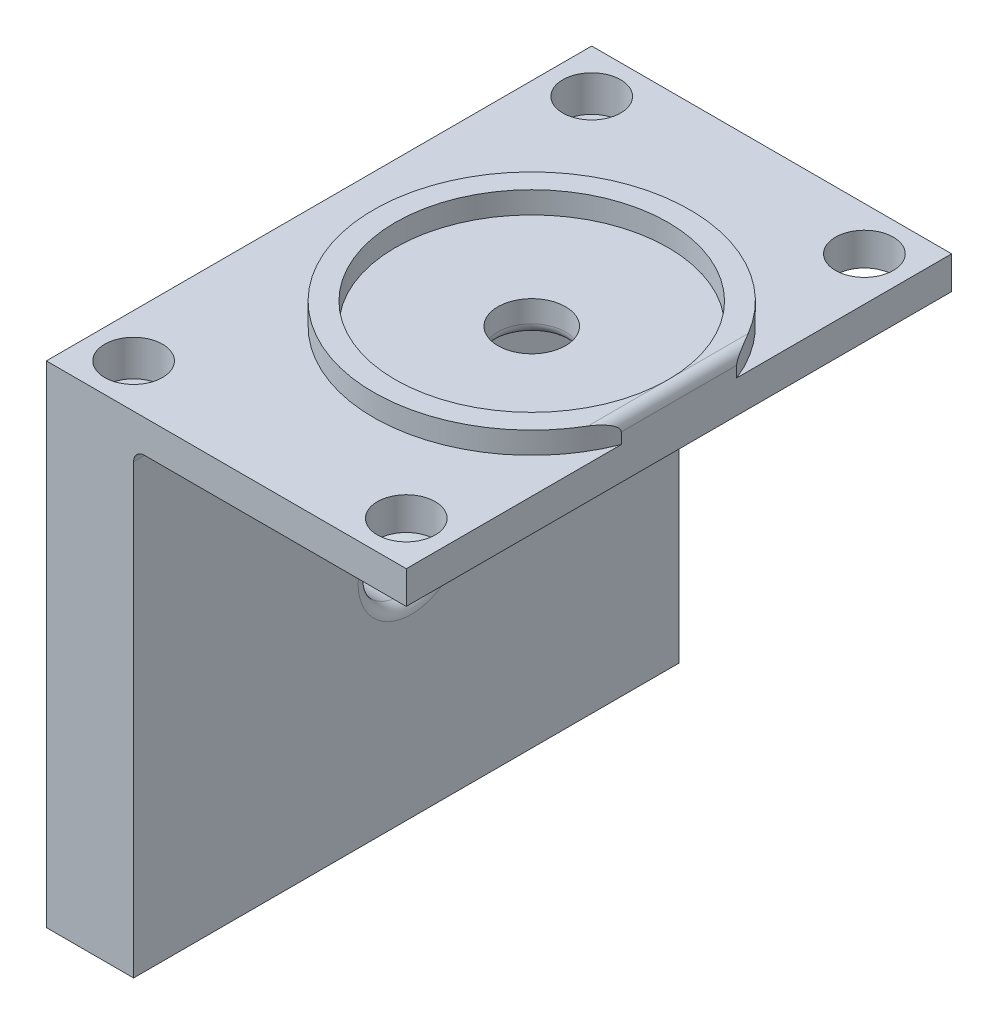
from build123d import *

# Parameters (mm, degrees)
SKETCH1_W           = 25
SKETCH1_H           = 50
SKETCH1_R           = 3.1
BOSS_EXTRUDE1_DEPTH = 3
SKETCH2_W           = 50
SKETCH2_H           = 3
BOSS_EXTRUDE2_DEPTH = 8
SKETCH3_W           = 8
SKETCH3_H           = 50
BOSS_EXTRUDE3_DEPTH = 42
SKETCH4_R           = 2.65
CUT_EXTRUDE1_DEPTH  = 3.3
FILLET1_R           = 1
SKETCH5_R           = 3.868246804
CUT_EXTRUDE2_DEPTH  = 9
FILLET2_R           = 1
SKETCH6_R           = 12.5
BOSS_EXTRUDE4_DEPTH = 2
FILLET3_R           = 1
FILLET4_R           = 1


with BuildPart() as part:
    # Sketch1 → Boss-Extrude1 (new body)
    with BuildSketch(Plane(origin=(0, 0, 0), x_dir=(1, 0, 0), z_dir=(0, 1, 0))):
        with Locations((2.276951673, 11.384758364)):
            Rectangle(SKETCH1_W, SKETCH1_H)
        with Locations(Location((1.276951673, 11.384758364, 0), (0, 0, 270))):
            Circle(SKETCH1_R, mode=Mode.SUBTRACT)
    extrude(amount=BOSS_EXTRUDE1_DEPTH)

    # Sketch2 → Boss-Extrude2 (add)
    with BuildSketch(Plane.ZY.offset(10.223048327)):
        with Locations((-11.384758364, 1.5)):
            Rectangle(SKETCH2_W, SKETCH2_H)
    extrude(amount=BOSS_EXTRUDE2_DEPTH)

    # Sketch3 → Boss-Extrude3 (add)
    with BuildSketch(Plane.XZ):
        with Locations((-14.223048327, -11.384758364)):
            Rectangle(SKETCH3_W, SKETCH3_H)
    extrude(amount=BOSS_EXTRUDE3_DEPTH)

    # Sketch4 → Cut-Extrude1 (cut)
    with BuildSketch(Plane(origin=(0, 3, 0), x_dir=(1, 0, 0), z_dir=(0, 1, 0))):
        with Locations(Location((-14.223048327, 32.384758364, 0), (0, 0, 270))):
            Circle(SKETCH4_R)
        with Locations(Location((-14.223048327, -9.615241636, 0), (0, 0, 270))):
            Circle(SKETCH4_R)
    cut_extrude1 = extrude(amount=-CUT_EXTRUDE1_DEPTH, mode=Mode.SUBTRACT)

    # Mirror1: Cut-Extrude1 across plane
    add(cut_extrude1.mirror(Plane.ZX.offset(-19.5)), mode=Mode.SUBTRACT)

    # Fillet1
    fillet1_edges = [part.edges().sort_by_distance(p)[0] for p in [
        (1.276951673, 0, -14.484758364),
    ]]
    fillet(fillet1_edges, radius=FILLET1_R)

    # Sketch5 → Cut-Extrude2 (cut)
    with BuildSketch(Plane.ZY.offset(18.223048327)):
        with Locations((-11.836279124, -21)):
            Circle(SKETCH5_R)
    extrude(amount=-CUT_EXTRUDE2_DEPTH, mode=Mode.SUBTRACT)

    # Fillet2
    fillet2_edges = [part.edges().sort_by_distance(p)[0] for p in [
        (-10.223048327, -21, -15.704525928),
    ]]
    fillet(fillet2_edges, radius=FILLET2_R)

    # Mirror2: Cut-Extrude1 across plane
    add(cut_extrude1.mirror(Plane.ZY.offset(1.723048327)), mode=Mode.SUBTRACT)

    # Sketch6 → Boss-Extrude4 (add)
    with BuildSketch(Plane(origin=(0, 3, 0), x_dir=(1, 0, 0), z_dir=(0, 1, 0))):
        with BuildLine():
            Line((14.776951673, 6.093255742), (14.776951673, 16.676260986))
            ThreePointArc((14.776951673, 16.676260986), (-13.223048327, 11.384758364), (14.776951673, 6.093255742))
        make_face()
        with Locations(Location((1.276951673, 11.384758364, 0), (0, 0, 270))):
            Circle(SKETCH6_R, mode=Mode.SUBTRACT)
    extrude(amount=BOSS_EXTRUDE4_DEPTH)

    # Fillet3
    fillet3_edges = [part.edges().sort_by_distance(p)[0] for p in [
        (-10.223048327, 0, -11.384758364),
    ]]
    fillet(fillet3_edges, radius=FILLET3_R)

    # Fillet4
    fillet4_edges = [part.edges().sort_by_distance(p)[0] for p in [
        (14.776951673, 5, -11.384758364),
    ]]
    fillet(fillet4_edges, radius=FILLET4_R - 0.0001)  # a hair under: the kernel refuses the full size


solid = part.part
